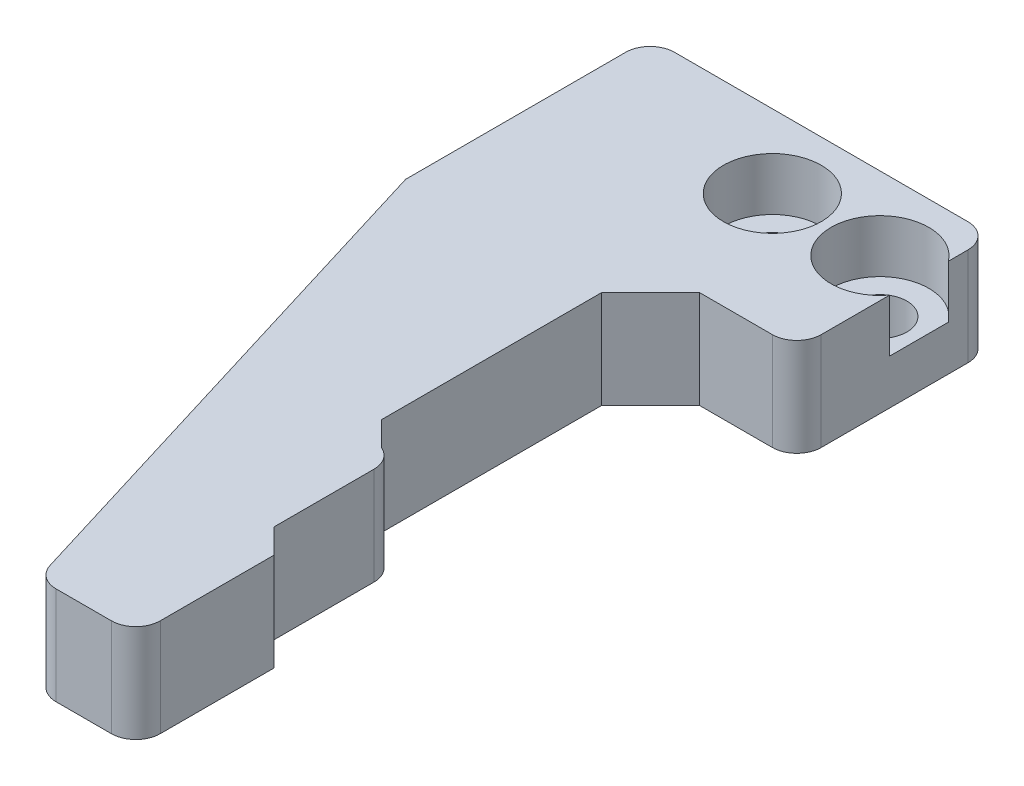
from build123d import *

# Parameters (mm, degrees)
BOSS_EXTRUDE1_DEPTH                                 = 10
CHAMFER1_SIZE                                       = 5
CHAMFER2_SIZE                                       = 2.5
FILLET1_R                                           = 2.5
CBORE_FOR_M5_HEX_SOCKET_HEAD_CAP_SCREW2_D           = 5.5
CBORE_FOR_M5_HEX_SOCKET_HEAD_CAP_SCREW2_DEPTH       = 10
CBORE_FOR_M5_HEX_SOCKET_HEAD_CAP_SCREW2_CBORE_D     = 10
CBORE_FOR_M5_HEX_SOCKET_HEAD_CAP_SCREW2_CBORE_DEPTH = 5.4
CBORE_FOR_M5_HEX_SOCKET_HEAD_CAP_SCREW2_TIP         = 1.652366702


# Some blends are built 0.0001 mm under size
with BuildPart() as part:
    # Sketch2 → Boss-Extrude1 (new body)
    with BuildSketch(Plane(origin=(0, 0, 0), x_dir=(1, 0, 0), z_dir=(0, 1, 0))):
        Polygon((0, 59.135462652), (-14.95, 59.135462652), (-14.95, 29.135462652), (-10.95, 29.135462652), (-10.95, 14.135462652), (-8.45, 14.135462652), (-8.45, 0), (-18.45, 0), (-35, 54.135462652), (-35, 79.135462652), (0, 79.135462652), align=None)
    extrude(amount=BOSS_EXTRUDE1_DEPTH)

    # Chamfer1
    chamfer1_edges = [part.edges().sort_by_distance(p)[0] for p in [
        (-14.95, 5, -59.135462652),
    ]]
    chamfer(chamfer1_edges, length=CHAMFER1_SIZE)

    # Chamfer2
    chamfer2_edges = [part.edges().sort_by_distance(p)[0] for p in [
        (-10.95, 5, -14.135462652),
        (-14.95, 5, -29.135462652),
    ]]
    chamfer(chamfer2_edges, length=CHAMFER2_SIZE - 0.0001)  # a hair under: the kernel refuses the full size

    # Fillet1
    # the kernel refuses this fillet: 2.5 mm, written as the material it takes off along each edge
    with BuildSketch(Plane(origin=(0, -6.25, -79.135462652), x_dir=(0, 0, 1), z_dir=(0, 1, 0)), Plane(origin=(-35, -6.25, -79.135462652), x_dir=(1, 0, 0), z_dir=(0, 1, 0)), Plane(origin=(0, -6.25, -59.135462652), x_dir=(-1, 0, 0), z_dir=(0, 1, 0))) as fillet1_piece_1:
        with BuildLine():
            CenterArc((FILLET1_R, -FILLET1_R), FILLET1_R, 90, 90)
            Line((0, -FILLET1_R), (-FILLET1_R * 0.02, -FILLET1_R))
            Line((-FILLET1_R * 0.02, -FILLET1_R), (-FILLET1_R * 0.02, FILLET1_R * 0.02))
            Line((-FILLET1_R * 0.02, FILLET1_R * 0.02), (FILLET1_R, FILLET1_R * 0.02))
            Line((FILLET1_R, FILLET1_R * 0.02), (FILLET1_R, 0))
        make_face()
    extrude(amount=22.5, mode=Mode.SUBTRACT)
    with BuildSketch(Plane(origin=(-8.45, -6.25, 0), x_dir=(0, 0, -1), z_dir=(0, 1, 0))) as fillet1_piece_2:
        with BuildLine():
            CenterArc((FILLET1_R, FILLET1_R), FILLET1_R, 180, 90)
            Line((0, FILLET1_R), (-FILLET1_R * 0.02, FILLET1_R))
            Line((-FILLET1_R * 0.02, FILLET1_R), (-FILLET1_R * 0.02, -FILLET1_R * 0.02))
            Line((-FILLET1_R * 0.02, -FILLET1_R * 0.02), (FILLET1_R, -FILLET1_R * 0.02))
            Line((FILLET1_R, -FILLET1_R * 0.02), (FILLET1_R, 0))
        make_face()
    extrude(amount=22.5, mode=Mode.SUBTRACT)
    with BuildSketch(Plane(origin=(-18.45, -4.62482795, 0), x_dir=(-0.29235761927834925, 0, -0.9563090622021188), z_dir=(0, 1, 0))) as fillet1_piece_3:
        with BuildLine():
            CenterArc((FILLET1_R * 0.739972471966, -FILLET1_R), FILLET1_R, 90, 73.00084391)
            Line((-FILLET1_R * 0.216336590236, -FILLET1_R * 0.707642380722), (-FILLET1_R * 0.23546277148, -FILLET1_R * 0.701795228336))
            Line((-FILLET1_R * 0.23546277148, -FILLET1_R * 0.701795228336), (-FILLET1_R * 0.0147994494393, FILLET1_R * 0.02))
            Line((-FILLET1_R * 0.0147994494393, FILLET1_R * 0.02), (FILLET1_R * 0.739972471966, FILLET1_R * 0.02))
            Line((FILLET1_R * 0.739972471966, FILLET1_R * 0.02), (FILLET1_R * 0.739972471966, 0))
        make_face()
    extrude(amount=19.2496559, mode=Mode.SUBTRACT)
    with BuildSketch(Plane(origin=(-10.95, -5.728328721, -29.135462652), x_dir=(-1, 0, 0), z_dir=(0, 1, 0))) as fillet1_piece_4:
        with BuildLine():
            CenterArc((2.5, 2.291331488), FILLET1_R, 180, 66.424322091)
            Line((0, 2.291331488), (-0.05, 2.291331488))
            Line((-0.05, 2.291331488), (-0.05, 0))
            Line((-0.05, 0), (0, -0.05))
            ThreePointArc((0, -0.05), (0.75005, -0.05), (1.480102, -0.04582663))
            Line((1.480102, -0.04582663), (1.5001, 0))
        make_face()
    extrude(amount=21.456657442, mode=Mode.SUBTRACT)

    # CBORE for M5 Hex Socket Head Cap Screw2
    with Locations(Plane(origin=(0, 10, 0), x_dir=(1, 0, 0), z_dir=(0, 1, 0))):
        with Locations((-15, 71.635462652), (-4, 71.635462652)):
            CounterBoreHole(CBORE_FOR_M5_HEX_SOCKET_HEAD_CAP_SCREW2_D / 2, CBORE_FOR_M5_HEX_SOCKET_HEAD_CAP_SCREW2_CBORE_D / 2, CBORE_FOR_M5_HEX_SOCKET_HEAD_CAP_SCREW2_CBORE_DEPTH, depth=CBORE_FOR_M5_HEX_SOCKET_HEAD_CAP_SCREW2_DEPTH)
            with Locations((0, 0, -(CBORE_FOR_M5_HEX_SOCKET_HEAD_CAP_SCREW2_DEPTH + CBORE_FOR_M5_HEX_SOCKET_HEAD_CAP_SCREW2_TIP / 2))):  # 118° drill point
                Cone(0, CBORE_FOR_M5_HEX_SOCKET_HEAD_CAP_SCREW2_D / 2, CBORE_FOR_M5_HEX_SOCKET_HEAD_CAP_SCREW2_TIP, mode=Mode.SUBTRACT)


solid = part.part
